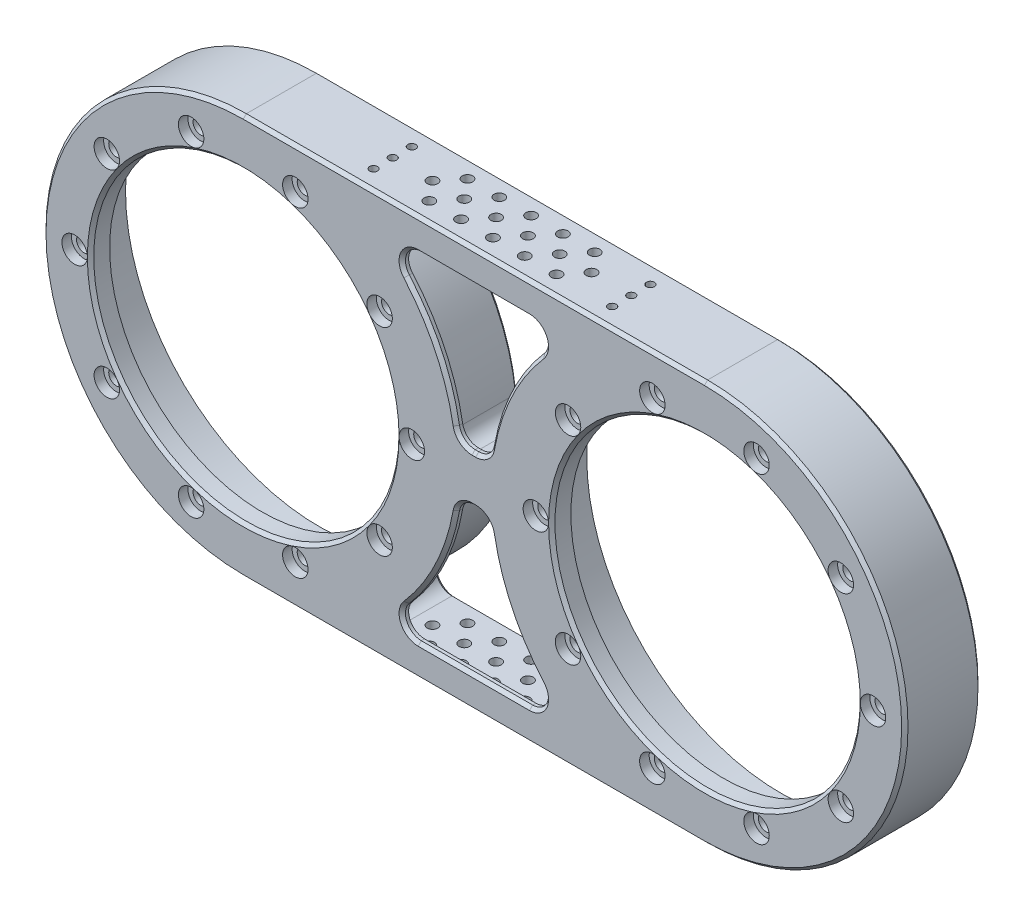
from build123d import *

# Parameters (mm, degrees)
SKETCH_1_R                   = 60
EXTRUDE_1_DEPTH              = 3
EXTRUDE_START                = 6
SKETCH_2_R                   = 48
EXTRUDE_2_DEPTH              = 6
SKETCH_3_R                   = 61
EXTRUDE_3_DEPTH              = 15
CUT_EXTRUDE_START            = -22
CUT_EXTRUDE_1_DEPTH          = 22
CUT_EXTRUDE_2_DEPTH          = 20
FILLET_2_R                   = 5
CHAMFER_2_SIZE               = 1
PATTERN_CIRCULAR_1_COUNT     = 10
PATTERN_CIRCULAR_2_COUNT     = 10
HOLE_WIZARD_M4_1_AT_2_COUNT  = 2
HOLE_WIZARD_M4_1_AT_2_PITCH  = 12
HOLE_WIZARD_M4_1_AT_3_COUNT  = 2
HOLE_WIZARD_M4_1_AT_3_PITCH  = 7.810249676
HOLE_WIZARD_M4_1_AT_4_COUNT  = 2
HOLE_WIZARD_M4_1_AT_4_PITCH  = 7.810249676
HOLE_WIZARD_M4_1_AT_5_COUNT  = 2
HOLE_WIZARD_M4_1_AT_5_PITCH  = 10
HOLE_WIZARD_M4_1_AT_6_COUNT  = 2
HOLE_WIZARD_M4_1_AT_6_PITCH  = 16.155494421
HOLE_WIZARD_M4_1_AT_7_COUNT  = 2
HOLE_WIZARD_M4_1_AT_7_PITCH  = 15.620499352
HOLE_WIZARD_M4_1_AT_8_COUNT  = 2
HOLE_WIZARD_M4_1_AT_8_PITCH  = 23.323807579
HOLE_WIZARD_M4_1_AT_9_COUNT  = 2
HOLE_WIZARD_M4_1_AT_9_PITCH  = 25.709920264
HOLE_WIZARD_M4_1_AT_10_COUNT = 2
HOLE_WIZARD_M4_1_AT_10_PITCH = 20
HOLE_WIZARD_M4_1_AT_11_COUNT = 2
HOLE_WIZARD_M4_1_AT_11_PITCH = 10
HOLE_WIZARD_M4_1_AT_12_COUNT = 2
HOLE_WIZARD_M4_1_AT_12_PITCH = 16.155494421
HOLE_WIZARD_M4_1_AT_13_COUNT = 2
HOLE_WIZARD_M4_1_AT_13_PITCH = 15.620499352
HOLE_WIZARD_M4_1_AT_14_COUNT = 2
HOLE_WIZARD_M4_1_AT_14_PITCH = 23.323807579
HOLE_WIZARD_M4_1_AT_15_COUNT = 2
HOLE_WIZARD_M4_1_AT_15_PITCH = 25.709920264
HOLE_WIZARD_M4_1_AT_16_COUNT = 2
HOLE_WIZARD_M4_1_AT_16_PITCH = 20
HOLE_WIZARD_M3_1_AT_2_COUNT  = 2
HOLE_WIZARD_M3_1_AT_2_PITCH  = 6
HOLE_WIZARD_M3_1_AT_3_COUNT  = 2
HOLE_WIZARD_M3_1_AT_3_PITCH  = 12
HOLE_WIZARD_M3_1_AT_4_COUNT  = 2
HOLE_WIZARD_M3_1_AT_4_PITCH  = 75.953933407
HOLE_WIZARD_M3_1_AT_5_COUNT  = 2
HOLE_WIZARD_M3_1_AT_5_PITCH  = 75.239617224
HOLE_WIZARD_M3_1_AT_6_COUNT  = 2
HOLE_WIZARD_M3_1_AT_6_PITCH  = 75


with BuildPart() as part:
    # 草图1 → 凸台-拉伸1 (new body)
    with BuildSketch(Plane.XY):
        with BuildLine():
            Line((0, 63), (145, 63))
            ThreePointArc((145, 63), (208, 0), (145, -63))
            Line((145, -63), (0, -63))
            ThreePointArc((0, -63), (-63, 0), (0, 63))
        make_face()
        Circle(SKETCH_1_R, mode=Mode.SUBTRACT)
        with Locations((145, 0)):
            Circle(SKETCH_1_R, mode=Mode.SUBTRACT)
    extrude(amount=-EXTRUDE_1_DEPTH)

    # 草图2 → 凸台-拉伸2 (add)
    with BuildSketch(Plane.XY.offset(EXTRUDE_START)):
        with BuildLine():
            Line((0, -63), (145, -63))
            ThreePointArc((145, -63), (208, 0), (145, 63))
            Line((145, 63), (0, 63))
            ThreePointArc((0, 63), (-63, 0), (0, -63))
        make_face()
        Circle(SKETCH_2_R, mode=Mode.SUBTRACT)
        with Locations((145, 0)):
            Circle(SKETCH_2_R, mode=Mode.SUBTRACT)
    extrude(amount=-EXTRUDE_2_DEPTH)

    # 草图3 → 凸台-拉伸3 (add)
    with BuildSketch(Plane(origin=(0, 0, -3), x_dir=(-1, 0, 0), z_dir=(0, 0, -1))):
        with BuildLine():
            Line((0, 63), (-145, 63))
            ThreePointArc((-145, 63), (-208, 0), (-145, -63))
            Line((-145, -63), (0, -63))
            ThreePointArc((0, -63), (63, 0), (0, 63))
        make_face()
        with Locations((-145, 0)):
            Circle(SKETCH_3_R, mode=Mode.SUBTRACT)
        Circle(SKETCH_3_R, mode=Mode.SUBTRACT)
    extrude(amount=EXTRUDE_3_DEPTH)

    # 草图4 → 切除-拉伸1 (cut)
    with BuildSketch(Plane(origin=(0, 0, -18), x_dir=(-1, 0, 0), z_dir=(0, 0, -1)).offset(CUT_EXTRUDE_START)):
        with BuildLine():
            ThreePointArc((-120.403252248, 58), (-93.171559203, 35.816375089), (-82.049622718, 2.5))
            Line((-82.049622718, 2.5), (-62.950377282, 2.5))
            ThreePointArc((-62.950377282, 2.5), (-51.828440797, 35.816375089), (-24.596747752, 58))
            Line((-24.596747752, 58), (-120.403252248, 58))
        make_face()
        with BuildLine():
            Line((-62.950377282, -2.5), (-82.049622718, -2.5))
            ThreePointArc((-82.049622718, -2.5), (-93.171559203, -35.816375089), (-120.403252248, -58))
            Line((-120.403252248, -58), (-24.596747752, -58))
            ThreePointArc((-24.596747752, -58), (-51.828440797, -35.816375089), (-62.950377282, -2.5))
        make_face()
    extrude(amount=CUT_EXTRUDE_1_DEPTH, mode=Mode.SUBTRACT)

    # 草图7 → 切除-拉伸2 (cut)
    with BuildSketch(Plane(origin=(0, 0, 4), x_dir=(-1, 0, 0), z_dir=(0, 0, -1))):
        with BuildLine():
            Line((-42.602816808, 53), (-102.397183192, 53))
            ThreePointArc((-102.397183192, 53), (-85.393721068, 32.72753446), (-77.414868499, 7.5))
            Line((-77.414868499, 7.5), (-67.585131501, 7.5))
            ThreePointArc((-67.585131501, 7.5), (-59.606278932, 32.72753446), (-42.602816808, 53))
        make_face()
        with BuildLine():
            Line((-67.585131501, -7.5), (-77.414868499, -7.5))
            ThreePointArc((-77.414868499, -7.5), (-85.393721068, -32.72753446), (-102.397183192, -53))
            Line((-102.397183192, -53), (-42.602816808, -53))
            ThreePointArc((-42.602816808, -53), (-59.606278932, -32.72753446), (-67.585131501, -7.5))
        make_face()
    extrude(amount=-CUT_EXTRUDE_2_DEPTH, mode=Mode.SUBTRACT)

    # 圆角2
    fillet_2_edges = [part.edges().sort_by_distance(p)[0] for p in [
        (42.602816808, 53, 5),
        (67.585131501, 7.5, 5),
        (77.414868499, 7.5, 5),
        (102.397183192, 53, 5),
        (24.596747752, 58, -7),
        (62.950377282, 2.5, -7),
        (82.049622718, 2.5, -7),
        (120.403252248, 58, -7),
        (62.950377282, -2.5, -7),
        (24.596747752, -58, -7),
        (120.403252248, -58, -7),
        (82.049622718, -2.5, -7),
        (67.585131501, -7.5, 5),
        (42.602816808, -53, 5),
        (102.397183192, -53, 5),
        (77.414868499, -7.5, 5),
    ]]
    fillet(fillet_2_edges, radius=FILLET_2_R)

    # 倒角2
    chamfer_2_edges = [part.edges().sort_by_distance(p)[0] for p in [
        (-60, 0, -3),
        (61.383052994, 29.259542121, 6),
        (72.5, 7.5, 6),
        (83.616947006, 29.259542121, 6),
        (61.383052994, -29.259542121, 6),
        (72.5, -53, 6),
        (83.616947006, -29.259542121, 6),
        (72.5, -7.5, 6),
        (72.5, 53, 6),
        (72.5, 2.5, -18),
        (89.776535695, 30.321098103, -18),
        (55.223464305, 30.321098103, -18),
        (72.5, 58, -18),
        (89.776535695, -30.321098103, -18),
        (72.5, -2.5, -18),
        (85, 0, -3),
        (72.5, -58, -18),
        (55.223464305, -30.321098103, -18),
        (68.703201021, 8.673721004, 6),
        (76.296798979, 8.673721004, 6),
        (50.448167613, -50.069014722, 6),
        (94.551832387, -50.069014722, 6),
        (76.296798979, -8.673721004, 6),
        (68.703201021, -8.673721004, 6),
        (50.448167613, 50.069014722, 6),
        (94.551832387, 50.069014722, 6),
        (80.749733343, 3.774590429, -18),
        (64.250266657, 3.774590429, -18),
        (37.886605717, 54.66052791, -18),
        (80.749733343, -3.774590429, -18),
        (107.113394283, -54.66052791, -18),
        (37.886605717, -54.66052791, -18),
        (64.250266657, -3.774590429, -18),
        (107.113394283, 54.66052791, -18),
        (-63, 0, 6),
        (72.5, -63, 6),
        (208, 0, 6),
        (72.5, 63, 6),
        (-48, 0, 6),
        (97, 0, 6),
        (-63, 0, -18),
        (72.5, 63, -18),
        (208, 0, -18),
        (72.5, -63, -18),
    ]]
    chamfer(chamfer_2_edges, length=CHAMFER_2_SIZE - 0.0001)  # a hair under: the kernel refuses the full size

    # 草图10 → 打孔尺寸(%根据)内六角圆柱头螺钉的类型1 (revolve, cut)
    with BuildSketch(Plane(origin=(198, 0, 6), x_dir=(0, -1, 0), z_dir=(1, 0, 0))):
        Polygon((0, 0), (0, 11.542065486), (2.4, 10.1), (2.4, 3), (4, 3), (4, 0), align=None)
    hole_wizard_1 = revolve(axis=Axis((198, 0, 12.35), (0, 0, -1)), mode=Mode.SUBTRACT)

    # 草图12 → 打孔尺寸(%根据)内六角圆柱头螺钉的类型2 (revolve, cut)
    with BuildSketch(Plane(origin=(53, 0, 6), x_dir=(0, -1, 0), z_dir=(1, 0, 0))):
        Polygon((0, 0), (0, 11.542065486), (2.4, 10.1), (2.4, 3), (4, 3), (4, 0), align=None)
    hole_wizard_2 = revolve(axis=Axis((53, 0, 12.35), (0, 0, -1)), mode=Mode.SUBTRACT)

    # 阵列(圆周)1: 打孔尺寸(%根据)内六角圆柱头螺钉的类型1 ×10 about axis
    pattern_circular_1_axis = Axis((145, 0, 0), (0, 0, 1))
    for i in range(1, PATTERN_CIRCULAR_1_COUNT):
        add(hole_wizard_1.rotate(pattern_circular_1_axis, i * 360 / PATTERN_CIRCULAR_1_COUNT), mode=Mode.SUBTRACT)

    # 阵列(圆周)2: 打孔尺寸(%根据)内六角圆柱头螺钉的类型2 ×10 about axis
    pattern_circular_2_axis = Axis((0, 0, 0), (0, 0, 1))
    for i in range(1, PATTERN_CIRCULAR_2_COUNT):
        add(hole_wizard_2.rotate(pattern_circular_2_axis, i * 360 / PATTERN_CIRCULAR_2_COUNT), mode=Mode.SUBTRACT)

    # 草图18 → M4 螺纹孔1 (revolve, cut)
    with BuildSketch(Plane(origin=(72.5, 63, -12), x_dir=(0, 0, 1), z_dir=(1, 0, 0))):
        Polygon((0, 0), (0, 11.091420021), (1.65, 10.1), (1.65, 0), align=None)
    hole_wizard_m4_1 = revolve(axis=Axis((72.5, 69.35, -12), (0, -1, 0)), mode=Mode.SUBTRACT)

    # M4 螺纹孔1 at 2: M4 螺纹孔1 ×2
    with Locations(*[(0, 0, i * HOLE_WIZARD_M4_1_AT_2_PITCH) for i in range(1, HOLE_WIZARD_M4_1_AT_2_COUNT)]):
        add(hole_wizard_m4_1, mode=Mode.SUBTRACT)

    # M4 螺纹孔1 at 3: M4 螺纹孔1 ×2
    with Locations(*[Vector(0.6401843996644799, 0, 0.7682212795973757) * (i * HOLE_WIZARD_M4_1_AT_3_PITCH) for i in range(1, HOLE_WIZARD_M4_1_AT_3_COUNT)]):
        add(hole_wizard_m4_1, mode=Mode.SUBTRACT)

    # M4 螺纹孔1 at 4: M4 螺纹孔1 ×2
    with Locations(*[Vector(-0.6401843996644809, 0, 0.768221279597375) * (i * HOLE_WIZARD_M4_1_AT_4_PITCH) for i in range(1, HOLE_WIZARD_M4_1_AT_4_COUNT)]):
        add(hole_wizard_m4_1, mode=Mode.SUBTRACT)

    # M4 螺纹孔1 at 5: M4 螺纹孔1 ×2
    with Locations(*[(-i * HOLE_WIZARD_M4_1_AT_5_PITCH, 0, 0) for i in range(1, HOLE_WIZARD_M4_1_AT_5_COUNT)]):
        add(hole_wizard_m4_1, mode=Mode.SUBTRACT)

    # M4 螺纹孔1 at 6: M4 螺纹孔1 ×2
    with Locations(*[Vector(-0.9284766908852594, 0, 0.3713906763541038) * (i * HOLE_WIZARD_M4_1_AT_6_PITCH) for i in range(1, HOLE_WIZARD_M4_1_AT_6_COUNT)]):
        add(hole_wizard_m4_1, mode=Mode.SUBTRACT)

    # M4 螺纹孔1 at 7: M4 螺纹孔1 ×2
    with Locations(*[Vector(-0.6401843996644804, 0, 0.7682212795973755) * (i * HOLE_WIZARD_M4_1_AT_7_PITCH) for i in range(1, HOLE_WIZARD_M4_1_AT_7_COUNT)]):
        add(hole_wizard_m4_1, mode=Mode.SUBTRACT)

    # M4 螺纹孔1 at 8: M4 螺纹孔1 ×2
    with Locations(*[Vector(-0.8574929257125442, 0, 0.5144957554275265) * (i * HOLE_WIZARD_M4_1_AT_8_PITCH) for i in range(1, HOLE_WIZARD_M4_1_AT_8_COUNT)]):
        add(hole_wizard_m4_1, mode=Mode.SUBTRACT)

    # M4 螺纹孔1 at 9: M4 螺纹孔1 ×2
    with Locations(*[Vector(-0.9723873019805175, 0, 0.23337295247532414) * (i * HOLE_WIZARD_M4_1_AT_9_PITCH) for i in range(1, HOLE_WIZARD_M4_1_AT_9_COUNT)]):
        add(hole_wizard_m4_1, mode=Mode.SUBTRACT)

    # M4 螺纹孔1 at 10: M4 螺纹孔1 ×2
    with Locations(*[(-i * HOLE_WIZARD_M4_1_AT_10_PITCH, 0, 0) for i in range(1, HOLE_WIZARD_M4_1_AT_10_COUNT)]):
        add(hole_wizard_m4_1, mode=Mode.SUBTRACT)

    # M4 螺纹孔1 at 11: M4 螺纹孔1 ×2
    with Locations(*[(i * HOLE_WIZARD_M4_1_AT_11_PITCH, 0, 0) for i in range(1, HOLE_WIZARD_M4_1_AT_11_COUNT)]):
        add(hole_wizard_m4_1, mode=Mode.SUBTRACT)

    # M4 螺纹孔1 at 12: M4 螺纹孔1 ×2
    with Locations(*[Vector(0.9284766908852594, 0, 0.37139067635410344) * (i * HOLE_WIZARD_M4_1_AT_12_PITCH) for i in range(1, HOLE_WIZARD_M4_1_AT_12_COUNT)]):
        add(hole_wizard_m4_1, mode=Mode.SUBTRACT)

    # M4 螺纹孔1 at 13: M4 螺纹孔1 ×2
    with Locations(*[Vector(0.6401843996644798, 0, 0.768221279597376) * (i * HOLE_WIZARD_M4_1_AT_13_PITCH) for i in range(1, HOLE_WIZARD_M4_1_AT_13_COUNT)]):
        add(hole_wizard_m4_1, mode=Mode.SUBTRACT)

    # M4 螺纹孔1 at 14: M4 螺纹孔1 ×2
    with Locations(*[Vector(0.8574929257125442, 0, 0.5144957554275267) * (i * HOLE_WIZARD_M4_1_AT_14_PITCH) for i in range(1, HOLE_WIZARD_M4_1_AT_14_COUNT)]):
        add(hole_wizard_m4_1, mode=Mode.SUBTRACT)

    # M4 螺纹孔1 at 15: M4 螺纹孔1 ×2
    with Locations(*[Vector(0.9723873019805176, 0, 0.23337295247532397) * (i * HOLE_WIZARD_M4_1_AT_15_PITCH) for i in range(1, HOLE_WIZARD_M4_1_AT_15_COUNT)]):
        add(hole_wizard_m4_1, mode=Mode.SUBTRACT)

    # M4 螺纹孔1 at 16: M4 螺纹孔1 ×2
    with Locations(*[(i * HOLE_WIZARD_M4_1_AT_16_PITCH, 0, 0) for i in range(1, HOLE_WIZARD_M4_1_AT_16_COUNT)]):
        add(hole_wizard_m4_1, mode=Mode.SUBTRACT)

    # 镜向1: M4 螺纹孔1 across plane
    add(hole_wizard_m4_1.mirror(Plane.ZX), mode=Mode.SUBTRACT)

    # 镜向1 copy 1 sketch → 镜向1 copy 1 (revolve, cut)
    with BuildSketch(Plane(origin=(72.5, -63, 0), x_dir=(0, 0, 1), z_dir=(1, 0, 0))):
        Polygon((0, 0), (0, -11.091420021), (1.65, -10.1), (1.65, 0), align=None)
    revolve(axis=Axis((72.5, -69.35, 0), (0, -1, 0)), mode=Mode.SUBTRACT)

    # 镜向1 copy 2 sketch → 镜向1 copy 2 (revolve, cut)
    with BuildSketch(Plane(origin=(77.5, -63, -6), x_dir=(0, 0, 1), z_dir=(1, 0, 0))):
        Polygon((0, 0), (0, -11.091420021), (1.65, -10.1), (1.65, 0), align=None)
    revolve(axis=Axis((77.5, -69.35, -6), (0, -1, 0)), mode=Mode.SUBTRACT)

    # 镜向1 copy 3 sketch → 镜向1 copy 3 (revolve, cut)
    with BuildSketch(Plane(origin=(67.5, -63, -6), x_dir=(0, 0, 1), z_dir=(1, 0, 0))):
        Polygon((0, 0), (0, -11.091420021), (1.65, -10.1), (1.65, 0), align=None)
    revolve(axis=Axis((67.5, -69.35, -6), (0, -1, 0)), mode=Mode.SUBTRACT)

    # 镜向1 copy 4 sketch → 镜向1 copy 4 (revolve, cut)
    with BuildSketch(Plane(origin=(62.5, -63, -12), x_dir=(0, 0, 1), z_dir=(1, 0, 0))):
        Polygon((0, 0), (0, -11.091420021), (1.65, -10.1), (1.65, 0), align=None)
    revolve(axis=Axis((62.5, -69.35, -12), (0, -1, 0)), mode=Mode.SUBTRACT)

    # 镜向1 copy 5 sketch → 镜向1 copy 5 (revolve, cut)
    with BuildSketch(Plane(origin=(57.5, -63, -6), x_dir=(0, 0, 1), z_dir=(1, 0, 0))):
        Polygon((0, 0), (0, -11.091420021), (1.65, -10.1), (1.65, 0), align=None)
    revolve(axis=Axis((57.5, -69.35, -6), (0, -1, 0)), mode=Mode.SUBTRACT)

    # 镜向1 copy 6 sketch → 镜向1 copy 6 (revolve, cut)
    with BuildSketch(Plane(origin=(62.5, -63, 0), x_dir=(0, 0, 1), z_dir=(1, 0, 0))):
        Polygon((0, 0), (0, -11.091420021), (1.65, -10.1), (1.65, 0), align=None)
    revolve(axis=Axis((62.5, -69.35, 0), (0, -1, 0)), mode=Mode.SUBTRACT)

    # 镜向1 copy 7 sketch → 镜向1 copy 7 (revolve, cut)
    with BuildSketch(Plane(origin=(52.5, -63, 0), x_dir=(0, 0, 1), z_dir=(1, 0, 0))):
        Polygon((0, 0), (0, -11.091420021), (1.65, -10.1), (1.65, 0), align=None)
    revolve(axis=Axis((52.5, -69.35, 0), (0, -1, 0)), mode=Mode.SUBTRACT)

    # 镜向1 copy 8 sketch → 镜向1 copy 8 (revolve, cut)
    with BuildSketch(Plane(origin=(47.5, -63, -6), x_dir=(0, 0, 1), z_dir=(1, 0, 0))):
        Polygon((0, 0), (0, -11.091420021), (1.65, -10.1), (1.65, 0), align=None)
    revolve(axis=Axis((47.5, -69.35, -6), (0, -1, 0)), mode=Mode.SUBTRACT)

    # 镜向1 copy 9 sketch → 镜向1 copy 9 (revolve, cut)
    with BuildSketch(Plane(origin=(52.5, -63, -12), x_dir=(0, 0, 1), z_dir=(1, 0, 0))):
        Polygon((0, 0), (0, -11.091420021), (1.65, -10.1), (1.65, 0), align=None)
    revolve(axis=Axis((52.5, -69.35, -12), (0, -1, 0)), mode=Mode.SUBTRACT)

    # 镜向1 copy 10 sketch → 镜向1 copy 10 (revolve, cut)
    with BuildSketch(Plane(origin=(82.5, -63, -12), x_dir=(0, 0, 1), z_dir=(1, 0, 0))):
        Polygon((0, 0), (0, -11.091420021), (1.65, -10.1), (1.65, 0), align=None)
    revolve(axis=Axis((82.5, -69.35, -12), (0, -1, 0)), mode=Mode.SUBTRACT)

    # 镜向1 copy 11 sketch → 镜向1 copy 11 (revolve, cut)
    with BuildSketch(Plane(origin=(87.5, -63, -6), x_dir=(0, 0, 1), z_dir=(1, 0, 0))):
        Polygon((0, 0), (0, -11.091420021), (1.65, -10.1), (1.65, 0), align=None)
    revolve(axis=Axis((87.5, -69.35, -6), (0, -1, 0)), mode=Mode.SUBTRACT)

    # 镜向1 copy 12 sketch → 镜向1 copy 12 (revolve, cut)
    with BuildSketch(Plane(origin=(82.5, -63, 0), x_dir=(0, 0, 1), z_dir=(1, 0, 0))):
        Polygon((0, 0), (0, -11.091420021), (1.65, -10.1), (1.65, 0), align=None)
    revolve(axis=Axis((82.5, -69.35, 0), (0, -1, 0)), mode=Mode.SUBTRACT)

    # 镜向1 copy 13 sketch → 镜向1 copy 13 (revolve, cut)
    with BuildSketch(Plane(origin=(92.5, -63, 0), x_dir=(0, 0, 1), z_dir=(1, 0, 0))):
        Polygon((0, 0), (0, -11.091420021), (1.65, -10.1), (1.65, 0), align=None)
    revolve(axis=Axis((92.5, -69.35, 0), (0, -1, 0)), mode=Mode.SUBTRACT)

    # 镜向1 copy 14 sketch → 镜向1 copy 14 (revolve, cut)
    with BuildSketch(Plane(origin=(97.5, -63, -6), x_dir=(0, 0, 1), z_dir=(1, 0, 0))):
        Polygon((0, 0), (0, -11.091420021), (1.65, -10.1), (1.65, 0), align=None)
    revolve(axis=Axis((97.5, -69.35, -6), (0, -1, 0)), mode=Mode.SUBTRACT)

    # 镜向1 copy 15 sketch → 镜向1 copy 15 (revolve, cut)
    with BuildSketch(Plane(origin=(92.5, -63, -12), x_dir=(0, 0, 1), z_dir=(1, 0, 0))):
        Polygon((0, 0), (0, -11.091420021), (1.65, -10.1), (1.65, 0), align=None)
    revolve(axis=Axis((92.5, -69.35, -12), (0, -1, 0)), mode=Mode.SUBTRACT)

    # 草图21 → M3 螺纹孔1 (revolve, cut)
    with BuildSketch(Plane(origin=(35, -63, 0), x_dir=(0, 0, -1), z_dir=(1, 0, 0))):
        Polygon((0, 0), (0, 8.251075774), (1.25, 7.5), (1.25, 0), align=None)
    hole_wizard_m3_1 = revolve(axis=Axis((35, -69.35, 0), (0, 1, 0)), mode=Mode.SUBTRACT)

    # M3 螺纹孔1 at 2: M3 螺纹孔1 ×2
    with Locations(*[(0, 0, -i * HOLE_WIZARD_M3_1_AT_2_PITCH) for i in range(1, HOLE_WIZARD_M3_1_AT_2_COUNT)]):
        add(hole_wizard_m3_1, mode=Mode.SUBTRACT)

    # M3 螺纹孔1 at 3: M3 螺纹孔1 ×2
    with Locations(*[(0, 0, -i * HOLE_WIZARD_M3_1_AT_3_PITCH) for i in range(1, HOLE_WIZARD_M3_1_AT_3_COUNT)]):
        add(hole_wizard_m3_1, mode=Mode.SUBTRACT)

    # M3 螺纹孔1 at 4: M3 螺纹孔1 ×2
    with Locations(*[Vector(0.9874406319167054, 0, -0.15799050110667287) * (i * HOLE_WIZARD_M3_1_AT_4_PITCH) for i in range(1, HOLE_WIZARD_M3_1_AT_4_COUNT)]):
        add(hole_wizard_m3_1, mode=Mode.SUBTRACT)

    # M3 螺纹孔1 at 5: M3 螺纹孔1 ×2
    with Locations(*[Vector(0.9968152785361251, 0, -0.07974522228288984) * (i * HOLE_WIZARD_M3_1_AT_5_PITCH) for i in range(1, HOLE_WIZARD_M3_1_AT_5_COUNT)]):
        add(hole_wizard_m3_1, mode=Mode.SUBTRACT)

    # M3 螺纹孔1 at 6: M3 螺纹孔1 ×2
    with Locations(*[(i * HOLE_WIZARD_M3_1_AT_6_PITCH, 0, 0) for i in range(1, HOLE_WIZARD_M3_1_AT_6_COUNT)]):
        add(hole_wizard_m3_1, mode=Mode.SUBTRACT)

    # 镜向2: M3 螺纹孔1 across plane
    add(hole_wizard_m3_1.mirror(Plane.ZX), mode=Mode.SUBTRACT)

    # 镜向2 copy 1 sketch → 镜向2 copy 1 (revolve, cut)
    with BuildSketch(Plane(origin=(35, 63, -6), x_dir=(0, 0, -1), z_dir=(1, 0, 0))):
        Polygon((0, 0), (0, -8.251075774), (1.25, -7.5), (1.25, 0), align=None)
    revolve(axis=Axis((35, 69.35, -6), (0, 1, 0)), mode=Mode.SUBTRACT)

    # 镜向2 copy 2 sketch → 镜向2 copy 2 (revolve, cut)
    with BuildSketch(Plane(origin=(35, 63, -12), x_dir=(0, 0, -1), z_dir=(1, 0, 0))):
        Polygon((0, 0), (0, -8.251075774), (1.25, -7.5), (1.25, 0), align=None)
    revolve(axis=Axis((35, 69.35, -12), (0, 1, 0)), mode=Mode.SUBTRACT)

    # 镜向2 copy 3 sketch → 镜向2 copy 3 (revolve, cut)
    with BuildSketch(Plane(origin=(110, 63, -12), x_dir=(0, 0, -1), z_dir=(1, 0, 0))):
        Polygon((0, 0), (0, -8.251075774), (1.25, -7.5), (1.25, 0), align=None)
    revolve(axis=Axis((110, 69.35, -12), (0, 1, 0)), mode=Mode.SUBTRACT)

    # 镜向2 copy 4 sketch → 镜向2 copy 4 (revolve, cut)
    with BuildSketch(Plane(origin=(110, 63, -6), x_dir=(0, 0, -1), z_dir=(1, 0, 0))):
        Polygon((0, 0), (0, -8.251075774), (1.25, -7.5), (1.25, 0), align=None)
    revolve(axis=Axis((110, 69.35, -6), (0, 1, 0)), mode=Mode.SUBTRACT)

    # 镜向2 copy 5 sketch → 镜向2 copy 5 (revolve, cut)
    with BuildSketch(Plane(origin=(110, 63, 0), x_dir=(0, 0, -1), z_dir=(1, 0, 0))):
        Polygon((0, 0), (0, -8.251075774), (1.25, -7.5), (1.25, 0), align=None)
    revolve(axis=Axis((110, 69.35, 0), (0, 1, 0)), mode=Mode.SUBTRACT)


solid = part.part
